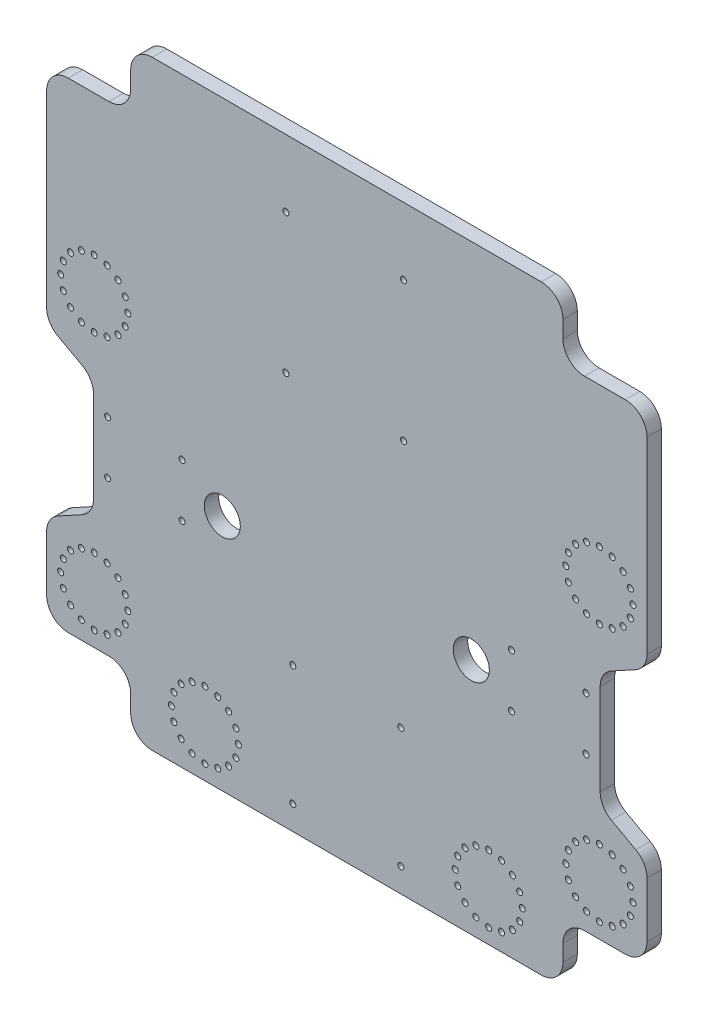
from build123d import *

# Parameters (mm, degrees)
SKETCH1_W               = 300
SKETCH1_H               = 250
BOSS_EXTRUDE1_DEPTH     = 6
CUT_EXTRUDE1_DEPTH      = 391.558574352
CUT_EXTRUDE1_DEPTH_BACK = 391.558574352
SKETCH3_R               = 7.5
SKETCH8_R               = 1.25
CUT_EXTRUDE4_DEPTH      = 382.041008292
SKETCH6_W               = 12.5
SKETCH6_H               = 92.656290199
SKETCH6_W_2             = 35
SKETCH6_H_2             = 25
CUT_EXTRUDE3_DEPTH      = 382.041008292
SKETCH5_R               = 1.25
CUT_EXTRUDE2_DEPTH      = 372.700147969
FILLET1_R               = 9


with BuildPart() as part:
    # Sketch1 → Boss-Extrude1 (new body)
    with BuildSketch(Plane.XY):
        with Locations((150, 125)):
            Rectangle(SKETCH1_W, SKETCH1_H)
    extrude(amount=-BOSS_EXTRUDE1_DEPTH)

    # Sketch3 → Cut-Extrude1 (cut, two sides: drawn at the far end of the back side and taken through both)
    with BuildSketch(Plane.XY.offset(-CUT_EXTRUDE1_DEPTH_BACK)):
        Polygon((0, 0), (25, 0), (25, 62.343709801), (44.5, 73.000027506), (44.5, 121.687392097), (25, 132.343709801), (12.5, 132.343709801), (12.5, 225), (25, 225), (25, 250), (0, 250), align=None)
        Polygon((275, 0), (300, 0), (300, 250), (275, 250), (275, 225), (287.5, 225), (287.5, 132.343709801), (275, 132.343709801), (255.5, 121.687392097), (255.5, 73.000027506), (275, 62.343709801), align=None)
        with Locations((201.85, 99.125843129)):
            Circle(SKETCH3_R)
        with Locations((98.15, 99.125843129)):
            Circle(SKETCH3_R)
    extrude(amount=CUT_EXTRUDE1_DEPTH + CUT_EXTRUDE1_DEPTH_BACK, mode=Mode.SUBTRACT)

    # Sketch8 → Cut-Extrude4 (cut, through all)
    with BuildSketch(Plane.XY):
        with Locations((209.09, 34.13)):
            Circle(SKETCH8_R)
        with Locations((209.09, 6.19)):
            Circle(SKETCH8_R)
        with Locations((214.43608755, 33.066597069)):
            Circle(SKETCH8_R)
        with Locations((203.74391245, 7.253402931)):
            Circle(SKETCH8_R)
        with Locations((218.968281733, 30.038281733)):
            Circle(SKETCH8_R)
        with Locations((199.211718267, 10.281718267)):
            Circle(SKETCH8_R)
        with Locations((221.996597069, 25.50608755)):
            Circle(SKETCH8_R)
        with Locations((196.183402931, 14.81391245)):
            Circle(SKETCH8_R)
        with Locations((223.06, 20.16)):
            Circle(SKETCH8_R)
        with Locations((195.12, 20.16)):
            Circle(SKETCH8_R)
        with Locations((221.996597069, 14.81391245)):
            Circle(SKETCH8_R)
        with Locations((196.183402931, 25.50608755)):
            Circle(SKETCH8_R)
        with Locations((218.968281733, 10.281718267)):
            Circle(SKETCH8_R)
        with Locations((199.211718267, 30.038281733)):
            Circle(SKETCH8_R)
        with Locations((214.43608755, 7.253402931)):
            Circle(SKETCH8_R)
        with Locations((203.74391245, 33.066597069)):
            Circle(SKETCH8_R)
        with Locations((76.94, 20.16)):
            Circle(SKETCH8_R)
        with Locations((104.88, 20.16)):
            Circle(SKETCH8_R)
        with Locations((255.16893536, 59.271223716)):
            Circle(SKETCH8_R)
        with Locations((103.816597069, 14.81391245)):
            Circle(SKETCH8_R)
        with Locations((78.003402931, 25.50608755)):
            Circle(SKETCH8_R)
        with Locations((100.788281733, 10.281718267)):
            Circle(SKETCH8_R)
        with Locations((81.031718267, 30.038281733)):
            Circle(SKETCH8_R)
        with Locations((96.25608755, 7.253402931)):
            Circle(SKETCH8_R)
        with Locations((85.56391245, 33.066597069)):
            Circle(SKETCH8_R)
        with Locations((90.91, 6.19)):
            Circle(SKETCH8_R)
        with Locations((90.91, 34.13)):
            Circle(SKETCH8_R)
        with Locations((85.56391245, 7.253402931)):
            Circle(SKETCH8_R)
        with Locations((96.25608755, 33.066597069)):
            Circle(SKETCH8_R)
        with Locations((81.031718267, 10.281718267)):
            Circle(SKETCH8_R)
        with Locations((100.788281733, 30.038281733)):
            Circle(SKETCH8_R)
        with Locations((78.003402931, 14.81391245)):
            Circle(SKETCH8_R)
        with Locations((103.816597069, 25.50608755)):
            Circle(SKETCH8_R)
        with Locations((255.16893536, 31.331223716)):
            Circle(SKETCH8_R)
        with Locations((260.51502291, 58.207820785)):
            Circle(SKETCH8_R)
        with Locations((249.82284781, 32.394626647)):
            Circle(SKETCH8_R)
        with Locations((265.047217093, 55.179505449)):
            Circle(SKETCH8_R)
        with Locations((245.290653627, 35.422941983)):
            Circle(SKETCH8_R)
        with Locations((268.075532429, 50.647311266)):
            Circle(SKETCH8_R)
        with Locations((242.262338291, 39.955136166)):
            Circle(SKETCH8_R)
        with Locations((269.13893536, 45.301223716)):
            Circle(SKETCH8_R)
        with Locations((241.19893536, 45.301223716)):
            Circle(SKETCH8_R)
        with Locations((268.075532429, 39.955136166)):
            Circle(SKETCH8_R)
        with Locations((242.262338291, 50.647311266)):
            Circle(SKETCH8_R)
        with Locations((265.047217093, 35.422941983)):
            Circle(SKETCH8_R)
        with Locations((245.290653627, 55.179505449)):
            Circle(SKETCH8_R)
        with Locations((260.51502291, 32.394626647)):
            Circle(SKETCH8_R)
        with Locations((249.82284781, 58.207820785)):
            Circle(SKETCH8_R)
        with Locations((44.83106464, 59.271223716)):
            Circle(SKETCH8_R)
        with Locations((44.83106464, 31.331223716)):
            Circle(SKETCH8_R)
        with Locations((50.17715219, 58.207820785)):
            Circle(SKETCH8_R)
        with Locations((39.48497709, 32.394626647)):
            Circle(SKETCH8_R)
        with Locations((54.709346373, 55.179505449)):
            Circle(SKETCH8_R)
        with Locations((34.952782907, 35.422941983)):
            Circle(SKETCH8_R)
        with Locations((57.737661709, 50.647311266)):
            Circle(SKETCH8_R)
        with Locations((31.924467571, 39.955136166)):
            Circle(SKETCH8_R)
        with Locations((58.80106464, 45.301223716)):
            Circle(SKETCH8_R)
        with Locations((30.86106464, 45.301223716)):
            Circle(SKETCH8_R)
        with Locations((57.737661709, 39.955136166)):
            Circle(SKETCH8_R)
        with Locations((31.924467571, 50.647311266)):
            Circle(SKETCH8_R)
        with Locations((54.709346373, 35.422941983)):
            Circle(SKETCH8_R)
        with Locations((34.952782907, 55.179505449)):
            Circle(SKETCH8_R)
        with Locations((50.17715219, 32.394626647)):
            Circle(SKETCH8_R)
        with Locations((39.48497709, 58.207820785)):
            Circle(SKETCH8_R)
        with Locations((255.16893536, 166.641143395)):
            Circle(SKETCH8_R)
        with Locations((255.16893536, 138.701143395)):
            Circle(SKETCH8_R)
        with Locations((249.82284781, 139.764546326)):
            Circle(SKETCH8_R)
        with Locations((260.51502291, 165.577740464)):
            Circle(SKETCH8_R)
        with Locations((245.290653627, 142.792861662)):
            Circle(SKETCH8_R)
        with Locations((265.047217093, 162.549425128)):
            Circle(SKETCH8_R)
        with Locations((242.262338291, 147.325055845)):
            Circle(SKETCH8_R)
        with Locations((268.075532429, 158.017230945)):
            Circle(SKETCH8_R)
        with Locations((241.19893536, 152.671143395)):
            Circle(SKETCH8_R)
        with Locations((269.13893536, 152.671143395)):
            Circle(SKETCH8_R)
        with Locations((242.262338291, 158.017230945)):
            Circle(SKETCH8_R)
        with Locations((268.075532429, 147.325055845)):
            Circle(SKETCH8_R)
        with Locations((245.290653627, 162.549425128)):
            Circle(SKETCH8_R)
        with Locations((265.047217093, 142.792861662)):
            Circle(SKETCH8_R)
        with Locations((249.82284781, 165.577740464)):
            Circle(SKETCH8_R)
        with Locations((260.51502291, 139.764546326)):
            Circle(SKETCH8_R)
        with Locations((44.83106464, 166.641143395)):
            Circle(SKETCH8_R)
        with Locations((44.83106464, 138.701143395)):
            Circle(SKETCH8_R)
        with Locations((39.48497709, 139.764546326)):
            Circle(SKETCH8_R)
        with Locations((50.17715219, 165.577740464)):
            Circle(SKETCH8_R)
        with Locations((34.952782907, 142.792861662)):
            Circle(SKETCH8_R)
        with Locations((54.709346373, 162.549425128)):
            Circle(SKETCH8_R)
        with Locations((31.924467571, 147.325055845)):
            Circle(SKETCH8_R)
        with Locations((57.737661709, 158.017230945)):
            Circle(SKETCH8_R)
        with Locations((30.86106464, 152.671143395)):
            Circle(SKETCH8_R)
        with Locations((58.80106464, 152.671143395)):
            Circle(SKETCH8_R)
        with Locations((31.924467571, 158.017230945)):
            Circle(SKETCH8_R)
        with Locations((57.737661709, 147.325055845)):
            Circle(SKETCH8_R)
        with Locations((34.952782907, 162.549425128)):
            Circle(SKETCH8_R)
        with Locations((54.709346373, 142.792861662)):
            Circle(SKETCH8_R)
        with Locations((39.48497709, 165.577740464)):
            Circle(SKETCH8_R)
        with Locations((50.17715219, 139.764546326)):
            Circle(SKETCH8_R)
    extrude(amount=-CUT_EXTRUDE4_DEPTH, mode=Mode.SUBTRACT)

    # Sketch6 → Cut-Extrude3 (cut, through all)
    with BuildSketch(Plane.XY):
        with Locations((281.25, 178.671854901)):
            Rectangle(SKETCH6_W, SKETCH6_H)
        with Locations((257.5, 237.5)):
            Rectangle(SKETCH6_W_2, SKETCH6_H_2)
        with Locations((257.5, 12.5)):
            Rectangle(SKETCH6_W_2, SKETCH6_H_2)
        with Locations((42.5, 12.5)):
            Rectangle(SKETCH6_W_2, SKETCH6_H_2)
        with Locations((42.5, 237.5)):
            Rectangle(SKETCH6_W_2, SKETCH6_H_2)
        with Locations((18.75, 178.671854901)):
            Rectangle(SKETCH6_W, SKETCH6_H)
    extrude(amount=-CUT_EXTRUDE3_DEPTH, mode=Mode.SUBTRACT)

    # Sketch5 → Cut-Extrude2 (cut, symmetric)
    with BuildSketch(Plane.XY):
        with Locations((50.4, 89.006293682)):
            Circle(SKETCH5_R)
    cut_extrude2 = extrude(amount=CUT_EXTRUDE2_DEPTH, both=True, mode=Mode.SUBTRACT)

    # Sketch-Pattern1: Cut-Extrude2 at 15 more places
    with Locations((77.1, -79.006294, 0), (122.1, -79.006294, 0), (77.1, -29.006294, 0), (122.1, -29.006294, 0), (74.245277, 75.015797, 0), (123.245277, 75.015797, 0), (74.245277, 133.015797, 0), (123.245277, 133.015797, 0), (168.2, 21.993706, 0), (199.2, 21.993706, 0), (199.2, -0.006294, 0), (168.2, -0.006294, 0), (31, 0, 0), (31, 22, 0), (0, 22, 0)):
        add(cut_extrude2, mode=Mode.SUBTRACT)

    # Fillet1
    fillet1_edges = [part.edges().sort_by_distance(p)[0] for p in [
        (255.5, 121.687392097, -3),
        (44.5, 121.687392097, -3),
        (44.5, 73.000027506, -3),
        (25, 62.343709801, -3),
        (255.5, 73.000027506, -3),
        (275, 62.343709801, -3),
        (240, 250, -3),
        (240, 225, -3),
        (60, 250, -3),
        (60, 225, -3),
        (60, 0, -3),
        (240, 0, -3),
        (275, 225, -3),
        (275, 132.343709801, -3),
        (25, 225, -3),
        (25, 132.343709801, -3),
        (60, 25, -3),
        (25, 25, -3),
        (275, 25, -3),
        (240, 25, -3),
    ]]
    fillet(fillet1_edges, radius=FILLET1_R)


solid = part.part
